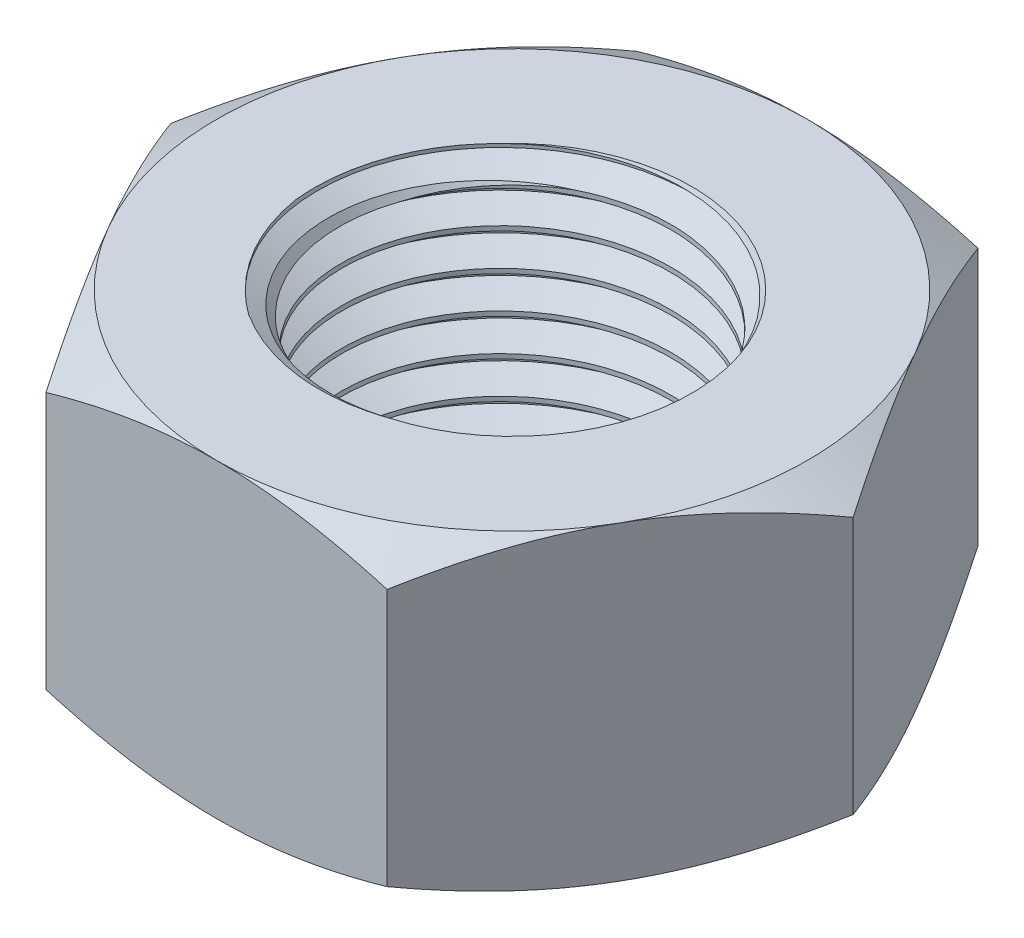
from build123d import *
from OCP.BRepFilletAPI import BRepFilletAPI_MakeChamfer

# Parameters (mm, degrees)
SKETCH_1_R      = 4.45875
EXTRUDE_1_DEPTH = 8.4
CHAMFER_3_SIZE  = 0.4
CHAMFER_3_SIZE2 = 0.692820323
SWEEP_1_PITCH   = 1


# Read off the part's stored shape, not the designer's step: 切除-旋转-薄壁1
with BuildPart() as part:
    # 草图1 → 凸台-拉伸1 (new body)
    with BuildSketch(Plane(origin=(0, 0, 0), x_dir=(1, 0, 0), z_dir=(0, 1, 0))):
        Polygon((9.237604307, 0), (4.618802154, 8), (-4.618802154, 8), (-9.237604307, 0), (-4.618802154, -8), (4.618802154, -8), align=None)
        with Locations(Location((0, 0, 0), (0, 0, 270))):
            Circle(SKETCH_1_R, mode=Mode.SUBTRACT)
    extrude(amount=EXTRUDE_1_DEPTH)

    # 倒角3: one chamfer whose edges measure the first distance from different faces: ONE call of the kernel's chamfer builder (chamfer() names one face for all edges)
    chamfer_3_edges_1 = [part.edges().sort_by_distance(p)[0] for p in [
        (0, 0, -4.45875),
    ]]
    chamfer_3_side_1 = [part.faces().sort_by_distance(p)[0] for p in [
        (0, 4.2, -4.45875),
    ]]
    chamfer_3_edges_2 = [part.edges().sort_by_distance(p)[0] for p in [
        (0, 8.4, -4.45875),
    ]]
    chamfer_3_side_2 = [part.faces().sort_by_distance(p)[0] for p in [
        (6.716543125, 8.4, -3.877797981),
    ]]
    chamfer_3 = BRepFilletAPI_MakeChamfer(part.part.solid().wrapped)
    for e in chamfer_3_edges_1:
        chamfer_3.Add(CHAMFER_3_SIZE, CHAMFER_3_SIZE2, e.wrapped, chamfer_3_side_1[0].wrapped)  # the first distance lies on this face
    for e in chamfer_3_edges_2:
        chamfer_3.Add(CHAMFER_3_SIZE, CHAMFER_3_SIZE2, e.wrapped, chamfer_3_side_2[0].wrapped)  # the first distance lies on this face
    add(Compound.cast(chamfer_3.Shape()), mode=Mode.REPLACE)

    # 切除-扫描1: the profile of 草图4 profile screwed along a right-hand helix of 10 turns, 8 arcs to a turn; built about Z, then put on its axis
    sweep_1_z = Axis((0, 0, 0), (0, 0, 1))
    sweep_1_corners = [(4.45845, 0, 0.000173205), (4.45845, 0, -0.875173205), (5.108269053, 0, -0.5), (5.108269053, 0, -0.375)]
    with BuildLine(mode=Mode.PRIVATE) as sweep_1_profile:
        Line(sweep_1_corners[0], sweep_1_corners[1])
        Line(sweep_1_corners[1], sweep_1_corners[2])
        Line(sweep_1_corners[2], sweep_1_corners[3])
        Line(sweep_1_corners[3], sweep_1_corners[0])
    sweep_1_cap = Face(sweep_1_profile.wire())
    sweep_1_turn_angles = [0, 22.5, 45, 67.5, 90, 112.5, 135, 157.5, 180, 202.5, 225, 247.5, 270, 292.5, 315, 337.5, 360]
    sweep_1_turn_weights = [1, 0.9238795325112867, 1, 0.9238795325112867, 1, 0.9238795325112867, 1, 0.9238795325112867, 1, 0.9238795325112867, 1, 0.9238795325112867, 1, 0.9238795325112867, 1, 0.9238795325112867, 1]
    sweep_1_turn_rails = [Edge.make_bspline([Vector(p[0], p[1], 0).rotate(sweep_1_z, sweep_1_turn_angles[k]) / sweep_1_turn_weights[k] + Vector(0, 0, p[2] + SWEEP_1_PITCH * sweep_1_turn_angles[k] / 360) for k in range(17)], [0, 0, 0, 1, 1, 2, 2, 3, 3, 4, 4, 5, 5, 6, 6, 7, 7, 8, 8, 8], 2, sweep_1_turn_weights) for p in sweep_1_corners]
    sweep_1_turn_sides = [Face.make_surface_from_curves(sweep_1_turn_rails[p[0]], sweep_1_turn_rails[p[1]]) for p in [(0, 1), (1, 2), (2, 3), (3, 0)]]
    sweep_1 = Plane(origin=(0, 0, 0), x_dir=(0, 0, 1), z_dir=(0, 1, 0)) * Solid(Shell([*[p.moved(Location((0, 0, SWEEP_1_PITCH * i))) for i in range(10) for p in sweep_1_turn_sides], sweep_1_cap, sweep_1_cap.rotate(sweep_1_z, 3600).moved(Location((0, 0, SWEEP_1_PITCH * 3600 / 360)))]))
    add(sweep_1, mode=Mode.SUBTRACT)

    # 切除-旋转-薄壁1 outline → 切除-旋转-薄壁1 (revolve, cut)
    with BuildSketch(Plane.XY):
        Polygon((9.237604311, 8.400000052), (7.999999955, 8.400000052), (9.237604311, 7.685468818), align=None)
    other_1 = revolve(axis=Axis((0, 0, 0), (0, 1, 0)), mode=Mode.SUBTRACT)

    # 镜向1: 切除-旋转-薄壁1 across plane
    add(other_1.mirror(Plane.ZX.offset(4.2)), mode=Mode.SUBTRACT)


solid = part.part
